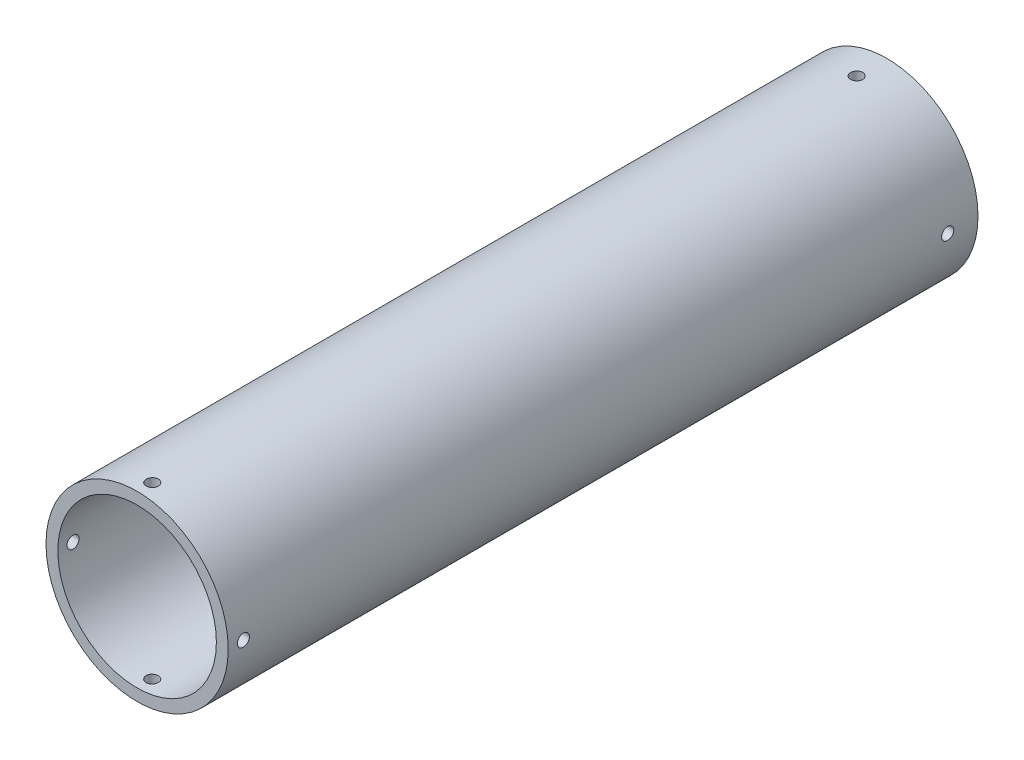
from build123d import *

# Parameters (mm, degrees)
SKETCH1_R                           = 30.099
SKETCH1_R_2                         = 26.1874
BOSS_EXTRUDE1_DEPTH                 = 247.7
F_4_0MM_DOWEL_HOLE1_D               = 4
F_4_0MM_DOWEL_HOLE1_DEPTH           = 6
F_4_0MM_DOWEL_HOLE1_TIP             = 1.201721238
F_4_0MM_DOWEL_HOLE1_ON_FACE_2_D     = 4
F_4_0MM_DOWEL_HOLE1_ON_FACE_2_DEPTH = 6
F_4_0MM_DOWEL_HOLE1_ON_FACE_2_TIP   = 1.201721238
F_4_0MM_DOWEL_HOLE1_ON_FACE_3_D     = 4
F_4_0MM_DOWEL_HOLE1_ON_FACE_3_DEPTH = 6
F_4_0MM_DOWEL_HOLE1_ON_FACE_3_TIP   = 1.201721238
F_4_0MM_DOWEL_HOLE1_ON_FACE_4_D     = 4
F_4_0MM_DOWEL_HOLE1_ON_FACE_4_DEPTH = 6
F_4_0MM_DOWEL_HOLE1_ON_FACE_4_TIP   = 1.201721238
F_4_0MM_DOWEL_HOLE2_D               = 4
F_4_0MM_DOWEL_HOLE2_DEPTH           = 6
F_4_0MM_DOWEL_HOLE2_TIP             = 1.201721238
F_4_0MM_DOWEL_HOLE2_ON_FACE_2_D     = 4
F_4_0MM_DOWEL_HOLE2_ON_FACE_2_DEPTH = 6
F_4_0MM_DOWEL_HOLE2_ON_FACE_2_TIP   = 1.201721238
F_4_0MM_DOWEL_HOLE2_ON_FACE_3_D     = 4
F_4_0MM_DOWEL_HOLE2_ON_FACE_3_DEPTH = 6
F_4_0MM_DOWEL_HOLE2_ON_FACE_3_TIP   = 1.201721238
F_4_0MM_DOWEL_HOLE2_ON_FACE_4_D     = 4
F_4_0MM_DOWEL_HOLE2_ON_FACE_4_DEPTH = 6
F_4_0MM_DOWEL_HOLE2_ON_FACE_4_TIP   = 1.201721238


with BuildPart() as part:
    # Sketch1 → Boss-Extrude1 (new body)
    with BuildSketch(Plane.XY):
        Circle(SKETCH1_R)
        Circle(SKETCH1_R_2, mode=Mode.SUBTRACT)
    extrude(amount=BOSS_EXTRUDE1_DEPTH)

    # Ø4.0mm Dowel Hole1
    with Locations(Plane(origin=(0, 30.099, 10), x_dir=(1, 0, 0), z_dir=(0, 1, 0))):
        with Locations((0, 0)):
            Hole(F_4_0MM_DOWEL_HOLE1_D / 2, depth=F_4_0MM_DOWEL_HOLE1_DEPTH)
            with Locations((0, 0, -(F_4_0MM_DOWEL_HOLE1_DEPTH + F_4_0MM_DOWEL_HOLE1_TIP / 2))):  # 118° drill point
                Cone(0, F_4_0MM_DOWEL_HOLE1_D / 2, F_4_0MM_DOWEL_HOLE1_TIP, mode=Mode.SUBTRACT)

    # Ø4.0mm Dowel Hole1 on face 2
    with Locations(Plane(origin=(30.099, 0, 10), x_dir=(0, 0, 1), z_dir=(1, 0, 0))):
        with Locations((0, 0)):
            Hole(F_4_0MM_DOWEL_HOLE1_ON_FACE_2_D / 2, depth=F_4_0MM_DOWEL_HOLE1_ON_FACE_2_DEPTH)
            with Locations((0, 0, -(F_4_0MM_DOWEL_HOLE1_ON_FACE_2_DEPTH + F_4_0MM_DOWEL_HOLE1_ON_FACE_2_TIP / 2))):  # 118° drill point
                Cone(0, F_4_0MM_DOWEL_HOLE1_ON_FACE_2_D / 2, F_4_0MM_DOWEL_HOLE1_ON_FACE_2_TIP, mode=Mode.SUBTRACT)

    # Ø4.0mm Dowel Hole1 on face 3
    with Locations(Plane(origin=(0, -30.099, 10), x_dir=(0, 0, -1), z_dir=(0, -1, 0))):
        with Locations((0, 0)):
            Hole(F_4_0MM_DOWEL_HOLE1_ON_FACE_3_D / 2, depth=F_4_0MM_DOWEL_HOLE1_ON_FACE_3_DEPTH)
            with Locations((0, 0, -(F_4_0MM_DOWEL_HOLE1_ON_FACE_3_DEPTH + F_4_0MM_DOWEL_HOLE1_ON_FACE_3_TIP / 2))):  # 118° drill point
                Cone(0, F_4_0MM_DOWEL_HOLE1_ON_FACE_3_D / 2, F_4_0MM_DOWEL_HOLE1_ON_FACE_3_TIP, mode=Mode.SUBTRACT)

    # Ø4.0mm Dowel Hole1 on face 4
    with Locations(Plane(origin=(-30.099, 0, 10), x_dir=(0, 0, -1), z_dir=(-1, 0, 0))):
        with Locations((0, 0)):
            Hole(F_4_0MM_DOWEL_HOLE1_ON_FACE_4_D / 2, depth=F_4_0MM_DOWEL_HOLE1_ON_FACE_4_DEPTH)
            with Locations((0, 0, -(F_4_0MM_DOWEL_HOLE1_ON_FACE_4_DEPTH + F_4_0MM_DOWEL_HOLE1_ON_FACE_4_TIP / 2))):  # 118° drill point
                Cone(0, F_4_0MM_DOWEL_HOLE1_ON_FACE_4_D / 2, F_4_0MM_DOWEL_HOLE1_ON_FACE_4_TIP, mode=Mode.SUBTRACT)

    # Ø4.0mm Dowel Hole2
    with Locations(Plane(origin=(0, -30.099, 242.7), x_dir=(-1, 0, 0), z_dir=(0, -1, 0))):
        with Locations((0, 0)):
            Hole(F_4_0MM_DOWEL_HOLE2_D / 2, depth=F_4_0MM_DOWEL_HOLE2_DEPTH)
            with Locations((0, 0, -(F_4_0MM_DOWEL_HOLE2_DEPTH + F_4_0MM_DOWEL_HOLE2_TIP / 2))):  # 118° drill point
                Cone(0, F_4_0MM_DOWEL_HOLE2_D / 2, F_4_0MM_DOWEL_HOLE2_TIP, mode=Mode.SUBTRACT)

    # Ø4.0mm Dowel Hole2 on face 2
    with Locations(Plane(origin=(-30.099, 0, 242.7), x_dir=(0, 0, -1), z_dir=(-1, 0, 0))):
        with Locations((0, 0)):
            Hole(F_4_0MM_DOWEL_HOLE2_ON_FACE_2_D / 2, depth=F_4_0MM_DOWEL_HOLE2_ON_FACE_2_DEPTH)
            with Locations((0, 0, -(F_4_0MM_DOWEL_HOLE2_ON_FACE_2_DEPTH + F_4_0MM_DOWEL_HOLE2_ON_FACE_2_TIP / 2))):  # 118° drill point
                Cone(0, F_4_0MM_DOWEL_HOLE2_ON_FACE_2_D / 2, F_4_0MM_DOWEL_HOLE2_ON_FACE_2_TIP, mode=Mode.SUBTRACT)

    # Ø4.0mm Dowel Hole2 on face 3
    with Locations(Plane(origin=(0, 30.099, 242.7), x_dir=(0, 0, 1), z_dir=(0, 1, 0))):
        with Locations((0, 0)):
            Hole(F_4_0MM_DOWEL_HOLE2_ON_FACE_3_D / 2, depth=F_4_0MM_DOWEL_HOLE2_ON_FACE_3_DEPTH)
            with Locations((0, 0, -(F_4_0MM_DOWEL_HOLE2_ON_FACE_3_DEPTH + F_4_0MM_DOWEL_HOLE2_ON_FACE_3_TIP / 2))):  # 118° drill point
                Cone(0, F_4_0MM_DOWEL_HOLE2_ON_FACE_3_D / 2, F_4_0MM_DOWEL_HOLE2_ON_FACE_3_TIP, mode=Mode.SUBTRACT)

    # Ø4.0mm Dowel Hole2 on face 4
    with Locations(Plane(origin=(30.099, 0, 242.7), x_dir=(0, 0, 1), z_dir=(1, 0, 0))):
        with Locations((0, 0)):
            Hole(F_4_0MM_DOWEL_HOLE2_ON_FACE_4_D / 2, depth=F_4_0MM_DOWEL_HOLE2_ON_FACE_4_DEPTH)
            with Locations((0, 0, -(F_4_0MM_DOWEL_HOLE2_ON_FACE_4_DEPTH + F_4_0MM_DOWEL_HOLE2_ON_FACE_4_TIP / 2))):  # 118° drill point
                Cone(0, F_4_0MM_DOWEL_HOLE2_ON_FACE_4_D / 2, F_4_0MM_DOWEL_HOLE2_ON_FACE_4_TIP, mode=Mode.SUBTRACT)


solid = part.part
